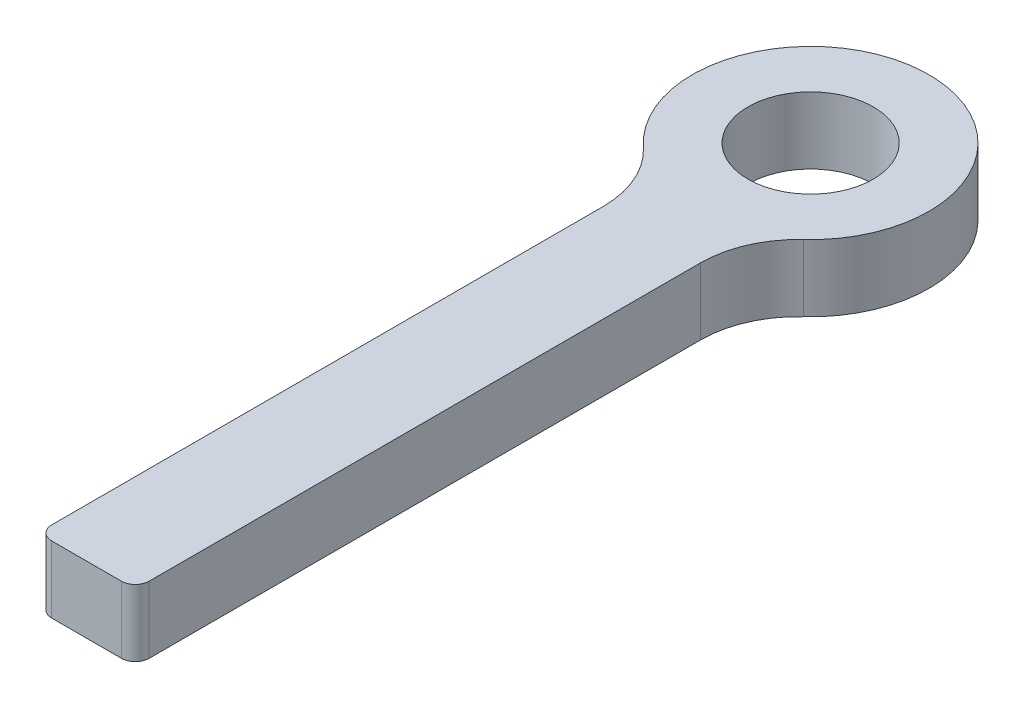
from build123d import *

# Parameters (mm, degrees)
ESBO_O1_R          = 4.5
FLANGE_BASE1_DEPTH = 4.8


# Sheet-metal steps are written as plain solids
with BuildPart() as part:
    # Esboço1 → Flange-base1 (new body)
    with BuildSketch(Plane(origin=(0, 0, 0), x_dir=(1, 0, 0), z_dir=(0, 1, 0))):
        with BuildLine():
            Line((-3.5, 40.598245749), (-3.5, 1))
            ThreePointArc((-3.5, 1), (-3.207106781, 0.292893219), (-2.5, 0))
            Line((-2.5, 0), (2.5, 0))
            ThreePointArc((2.5, 0), (3.207106781, 0.292893219), (3.5, 1))
            Line((3.5, 1), (3.5, 40.598245749))
            ThreePointArc((3.5, 40.598245749), (4.089323422, 43.4095134), (5.758064516, 45.747425088))
            ThreePointArc((5.758064516, 45.747425088), (0, 60.5), (-5.758064516, 45.747425088))
            ThreePointArc((-5.758064516, 45.747425088), (-4.089323422, 43.4095134), (-3.5, 40.598245749))
        make_face()
        with Locations(Location((0, 52, 0), (0, 0, 270))):
            Circle(ESBO_O1_R, mode=Mode.SUBTRACT)
    extrude(amount=-FLANGE_BASE1_DEPTH)


solid = part.part
